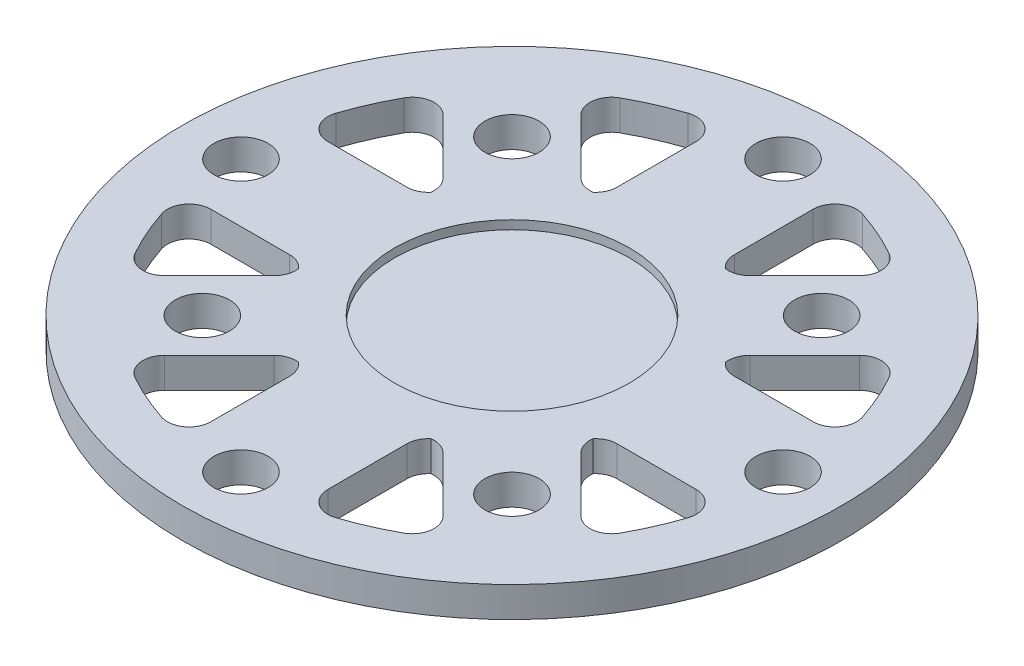
from build123d import *

# Parameters (mm, degrees)
SKETCH1_R           = 76
SKETCH1_R_2         = 27.051
SKETCH1_R_3         = 6.25
BOSS_EXTRUDE1_DEPTH = 7
SKETCH3_R           = 27.051
BOSS_EXTRUDE2_DEPTH = 5
SKETCH4_R           = 6.25
CUT_EXTRUDE1_DEPTH  = 10
FILLET1_R           = 5


with BuildPart() as part:
    # Sketch1 → Boss-Extrude1 (new body)
    with BuildSketch(Plane(origin=(0, 0, 0), x_dir=(1, 0, 0), z_dir=(0, 1, 0))):
        with Locations(Location((0, 0, 0), (0, 0, 270))):
            Circle(SKETCH1_R)
        with Locations(Location((0, 0, 0), (0, 0, 270))):
            Circle(SKETCH1_R_2, mode=Mode.SUBTRACT)
        with Locations(Location((0, 62.5, 0), (0, 0, 270))):
            Circle(SKETCH1_R_3, mode=Mode.SUBTRACT)
        with Locations(Location((62.5, 0, 0), (0, 0, 270))):
            Circle(SKETCH1_R_3, mode=Mode.SUBTRACT)
        with Locations(Location((0, -62.5, 0), (0, 0, 270))):
            Circle(SKETCH1_R_3, mode=Mode.SUBTRACT)
        with Locations(Location((-62.5, 0, 0), (0, 0, 270))):
            Circle(SKETCH1_R_3, mode=Mode.SUBTRACT)
    extrude(amount=BOSS_EXTRUDE1_DEPTH)

    # Sketch3 → Boss-Extrude2 (add)
    with BuildSketch(Plane.XZ):
        with Locations(Location((0, 0, 0), (0, 0, 270))):
            Circle(SKETCH3_R)
    extrude(amount=-BOSS_EXTRUDE2_DEPTH)

    # Sketch4 → Cut-Extrude1 (cut)
    with BuildSketch(Plane(origin=(0, 7, 0), x_dir=(1, 0, 0), z_dir=(0, 1, 0))):
        with BuildLine():
            Line((27.751246841, -43.661149418), (17.007161012, -32.917063589))
            ThreePointArc((17.007161012, -32.917063589), (15.274204293, -33.756114768), (13.5, -34.504008477))
            Line((13.5, -34.504008477), (13.5, -62.5))
            ThreePointArc((13.5, -62.5), (25.524772494, -58.625813335), (36.553123822, -52.463026398))
            Line((36.553123822, -52.463026398), (27.751246841, -43.661149418))
        make_face()
        with BuildLine():
            Line((62.5, -13.5), (34.504008477, -13.5))
            ThreePointArc((34.504008477, -13.5), (33.756114768, -15.274204293), (32.917063589, -17.007161012))
            Line((32.917063589, -17.007161012), (43.66114941, -27.751246833))
            Line((43.66114941, -27.751246833), (52.463026398, -36.553123822))
            ThreePointArc((52.463026398, -36.553123822), (58.625813335, -25.524772494), (62.5, -13.5))
        make_face()
        with BuildLine():
            ThreePointArc((-13.5, -34.504008477), (-15.274204293, -33.756114768), (-17.007161012, -32.917063589))
            Line((-17.007161012, -32.917063589), (-27.751246874, -43.66114945))
            Line((-27.751246874, -43.66114945), (-36.553123822, -52.463026398))
            ThreePointArc((-36.553123822, -52.463026398), (-25.524772494, -58.625813335), (-13.5, -62.5))
            Line((-13.5, -62.5), (-13.5, -34.504008477))
        make_face()
        with BuildLine():
            ThreePointArc((-32.917063589, -17.007161012), (-33.756114768, -15.274204293), (-34.504008477, -13.5))
            Line((-34.504008477, -13.5), (-62.5, -13.5))
            ThreePointArc((-62.5, -13.5), (-58.625813335, -25.524772494), (-52.463026398, -36.553123822))
            Line((-52.463026398, -36.553123822), (-43.661149471, -27.751246894))
            Line((-43.661149471, -27.751246894), (-32.917063589, -17.007161012))
        make_face()
        with BuildLine():
            ThreePointArc((-34.504008477, 13.5), (-33.756114768, 15.274204293), (-32.917063589, 17.007161012))
            Line((-32.917063589, 17.007161012), (-43.66114943, 27.751246854))
            Line((-43.66114943, 27.751246854), (-52.463026398, 36.553123822))
            ThreePointArc((-52.463026398, 36.553123822), (-58.625813335, 25.524772494), (-62.5, 13.5))
            Line((-62.5, 13.5), (-34.504008477, 13.5))
        make_face()
        with BuildLine():
            ThreePointArc((-17.007161012, 32.917063589), (-15.274204293, 33.756114768), (-13.5, 34.504008477))
            Line((-13.5, 34.504008477), (-13.5, 62.5))
            ThreePointArc((-13.5, 62.5), (-25.524772494, 58.625813335), (-36.553123822, 52.463026398))
            Line((-36.553123822, 52.463026398), (-27.751246874, 43.66114945))
            Line((-27.751246874, 43.66114945), (-17.007161012, 32.917063589))
        make_face()
        with BuildLine():
            ThreePointArc((36.553123822, 52.463026398), (25.524772494, 58.625813335), (13.5, 62.5))
            Line((13.5, 62.5), (13.5, 34.504008477))
            ThreePointArc((13.5, 34.504008477), (15.274204293, 33.756114768), (17.007161012, 32.917063589))
            Line((17.007161012, 32.917063589), (27.751246906, 43.661149483))
            Line((27.751246906, 43.661149483), (36.553123822, 52.463026398))
        make_face()
        with BuildLine():
            ThreePointArc((62.5, 13.5), (58.625813335, 25.524772494), (52.463026398, 36.553123822))
            Line((52.463026398, 36.553123822), (43.66114945, 27.751246874))
            Line((43.66114945, 27.751246874), (32.917063589, 17.007161012))
            ThreePointArc((32.917063589, 17.007161012), (33.756114768, 15.274204293), (34.504008477, 13.5))
            Line((34.504008477, 13.5), (62.5, 13.5))
        make_face()
        with Locations(Location((35.706198162, 35.706198162, 0), (0, 0, 270))):
            Circle(SKETCH4_R)
        with Locations(Location((35.706198162, -35.706198162, 0), (0, 0, 270))):
            Circle(SKETCH4_R)
        with Locations(Location((-35.706198162, -35.706198162, 0), (0, 0, 270))):
            Circle(SKETCH4_R)
        with Locations(Location((-35.706198162, 35.706198162, 0), (0, 0, 270))):
            Circle(SKETCH4_R)
    extrude(amount=-CUT_EXTRUDE1_DEPTH, mode=Mode.SUBTRACT)

    # Fillet1
    # the kernel refuses this fillet: 5 mm, written as the material it adds along each edge
    with BuildSketch(Plane(origin=(34.504008477, 7, 13.5), x_dir=(1, 0, 0), z_dir=(0, -1, 0)), Plane(origin=(13.5, 7, -34.504008477), x_dir=(0, 0, -1), z_dir=(0, -1, 0)), Plane(origin=(-34.504008477, 7, -13.5), x_dir=(-1, 0, 0), z_dir=(0, -1, 0)), Plane(origin=(-13.5, 7, 34.504008477), x_dir=(0, 0, 1), z_dir=(0, -1, 0))) as fillet1_piece_1:
        with BuildLine():
            CenterArc((3.258891319, 5), FILLET1_R, 206.100178987, 63.899821013)
            ThreePointArc((-1.231239688, 2.800290124), (-0.586707725, 1.412857227), (0, 0))
            Line((0, 0), (3.258891319, 0))
        make_face()
    extrude(amount=7)
    with BuildSketch(Plane(origin=(62.5, 7, 13.5), x_dir=(-1, 0, 0), z_dir=(0, -1, 0))) as fillet1_piece_2:
        with BuildLine():
            CenterArc((6.537189081, -5), FILLET1_R, 90, 108.2926811)
            ThreePointArc((1.789861186, -6.569355874), (0.807426008, -3.308519097), (0, 0))
            Line((0, 0), (6.537189081, 0))
        make_face()
    extrude(amount=7)
    with BuildSketch(Plane(origin=(52.463026398, 7, 36.553123822), x_dir=(-0.7071067811865521, 0, -0.707106781186543), z_dir=(0, -1, 0)), Plane(origin=(-36.553123822, 7, 52.463026398), x_dir=(0.7071067811865515, 0, -0.7071067811865436), z_dir=(0, -1, 0))) as fillet1_piece_3:
        with BuildLine():
            CenterArc((6.286852353, 5), FILLET1_R, 163.996405934, 106.003594066)
            ThreePointArc((1.480630334, 6.378488268), (0.658610883, 3.208210045), (0, 0))
            Line((0, 0), (6.286852353, 0))
        make_face()
    extrude(amount=7)
    with BuildSketch(Plane(origin=(32.917063589, 7, 17.007161012), x_dir=(0.4193809358930841, 0, -0.907810349472532), z_dir=(0, -1, 0)), Plane(origin=(17.007161012, 7, -32.917063589), x_dir=(-0.9078103494725283, 0, -0.41938093589309267), z_dir=(0, -1, 0)), Plane(origin=(-32.917063589, 7, -17.007161012), x_dir=(-0.4193809358930852, 0, 0.9078103494725317), z_dir=(0, -1, 0))) as fillet1_piece_4:
        with BuildLine():
            CenterArc((3.489548398, 4.995132399), FILLET1_R, 200.204490443, 67.267112024)
            Line((-1.202781391, 3.268273647), (0, 0))
            ThreePointArc((0, 0), (1.634487847, 0.036069898), (3.268975694, 0))
        make_face()
    extrude(amount=7)
    with BuildSketch(Plane(origin=(32.917063589, 7, -17.007161012), x_dir=(0.7071067811865526, 0, -0.7071067811865425), z_dir=(0, -1, 0)), Plane(origin=(-17.007161012, 7, -32.917063589), x_dir=(-0.7071067811865506, 0, -0.7071067811865445), z_dir=(0, -1, 0)), Plane(origin=(-32.917063589, 7, 17.007161012), x_dir=(-0.7071067811865506, 0, 0.7071067811865445), z_dir=(0, -1, 0)), Plane(origin=(17.007161012, 7, 32.917063589), x_dir=(0.7071067811865501, 0, 0.707106781186545), z_dir=(0, -1, 0))) as fillet1_piece_5:
        with BuildLine():
            CenterArc((3.482570273, 5), FILLET1_R, 202.732887976, 67.267112024)
            ThreePointArc((-1.129011858, 3.067822406), (-0.530655558, 1.546368727), (0, 0))
            Line((0, 0), (3.482570273, 0))
        make_face()
    extrude(amount=7)
    with BuildSketch(Plane(origin=(34.504008477, 7, -13.5), x_dir=(1, 0, 0), z_dir=(0, -1, 0))) as fillet1_piece_6:
        with BuildLine():
            CenterArc((3.258891319, -5), FILLET1_R, 90, 63.899821013)
            ThreePointArc((-1.231239688, -2.800290124), (-0.586707725, -1.412857227), (0, 0))
            Line((0, 0), (3.258891319, 0))
        make_face()
    extrude(amount=7)
    with BuildSketch(Plane(origin=(62.5, 7, -13.5), x_dir=(-1, 0, 0), z_dir=(0, -1, 0)), Plane(origin=(-13.5, 7, -62.5), x_dir=(0, 0, 1), z_dir=(0, -1, 0)), Plane(origin=(-62.5, 7, 13.5), x_dir=(1, 0, 0), z_dir=(0, -1, 0)), Plane(origin=(13.5, 7, 62.5), x_dir=(0, 0, -1), z_dir=(0, -1, 0))) as fillet1_piece_7:
        with BuildLine():
            CenterArc((6.537189081, 5), FILLET1_R, 161.7073189, 108.2926811)
            ThreePointArc((1.789861186, 6.569355874), (0.807426008, 3.308519097), (0, 0))
            Line((0, 0), (6.537189081, 0))
        make_face()
    extrude(amount=7)
    with BuildSketch(Plane(origin=(52.463026398, 7, -36.553123822), x_dir=(0.5289042688396526, 0, 0.848681491728901), z_dir=(0, -1, 0))) as fillet1_piece_8:
        with BuildLine():
            CenterArc((6.292063112, 4.993441128), FILLET1_R, 166.931450544, 106.003594066)
            Line((1.421561948, 6.124024341), (0, 0))
            ThreePointArc((0, 0), (3.274041034, -0.08387667), (6.548082068, 0))
        make_face()
    extrude(amount=7)
    with BuildSketch(Plane(origin=(36.553123822, 7, -52.463026398), x_dir=(-0.8486814917288963, 0, -0.52890426883966), z_dir=(0, -1, 0)), Plane(origin=(-52.463026398, 7, -36.553123822), x_dir=(-0.5289042688396536, 0, 0.8486814917289003), z_dir=(0, -1, 0))) as fillet1_piece_9:
        with BuildLine():
            CenterArc((6.292063112, -4.993441128), FILLET1_R, 87.06495539, 106.003594066)
            Line((1.421561948, -6.124024341), (0, 0))
            ThreePointArc((0, 0), (3.274041034, 0.08387667), (6.548082068, 0))
        make_face()
    extrude(amount=7)
    with BuildSketch(Plane(origin=(13.5, 7, -62.5), x_dir=(0.9648302017860143, 0, 0.26287388938720957), z_dir=(0, -1, 0)), Plane(origin=(-62.5, 7, -13.5), x_dir=(0.2628738893872084, 0, -0.9648302017860146), z_dir=(0, -1, 0)), Plane(origin=(-13.5, 7, 62.5), x_dir=(-0.9648302017860145, 0, -0.26287388938720885), z_dir=(0, -1, 0))) as fillet1_piece_10:
        with BuildLine():
            CenterArc((6.542607328, 4.992908013), FILLET1_R, 164.759342849, 108.2926811)
            Line((1.718456319, 6.30727746), (0, 0))
            ThreePointArc((0, 0), (3.404410363, -0.090694285), (6.808820725, 0))
        make_face()
    extrude(amount=7)
    with BuildSketch(Plane(origin=(-36.553123822, 7, -52.463026398), x_dir=(0.707106781186552, 0, 0.7071067811865429), z_dir=(0, -1, 0)), Plane(origin=(-52.463026398, 7, 36.553123822), x_dir=(0.7071067811865515, 0, -0.7071067811865436), z_dir=(0, -1, 0)), Plane(origin=(36.553123822, 7, 52.463026398), x_dir=(-0.7071067811865527, 0, -0.7071067811865425), z_dir=(0, -1, 0))) as fillet1_piece_11:
        with BuildLine():
            CenterArc((6.286852353, -5), FILLET1_R, 90, 106.003594066)
            ThreePointArc((1.480630334, -6.378488268), (0.658610883, -3.208210045), (0, 0))
            Line((0, 0), (6.286852353, 0))
        make_face()
    extrude(amount=7)
    with BuildSketch(Plane(origin=(-13.5, 7, -34.504008477), x_dir=(-0.9154220062230544, 0, 0.4024954043496127), z_dir=(0, -1, 0)), Plane(origin=(-34.504008477, 7, 13.5), x_dir=(0.4024954043496181, 0, 0.915422006223052), z_dir=(0, -1, 0)), Plane(origin=(13.5, 7, 34.504008477), x_dir=(0.915422006223051, 0, -0.40249540434962), z_dir=(0, -1, 0))) as fillet1_piece_12:
        with BuildLine():
            CenterArc((3.265421252, 4.995737851), FILLET1_R, 203.734271223, 63.899821013)
            Line((-1.311688779, 2.983260829), (0, 0))
            ThreePointArc((0, 0), (1.52950776, 0.031583378), (3.059015519, 0))
        make_face()
    extrude(amount=7)
    with BuildSketch(Plane(origin=(-17.007161012, 7, 32.917063589), x_dir=(-0.7071067811865496, 0, 0.7071067811865455), z_dir=(0, -1, 0))) as fillet1_piece_13:
        with BuildLine():
            CenterArc((3.482570273, -5), FILLET1_R, 90, 67.267112024)
            ThreePointArc((-1.129011858, -3.067822406), (-0.530655558, -1.546368727), (0, 0))
            Line((0, 0), (3.482570273, 0))
        make_face()
    extrude(amount=7)


solid = part.part
